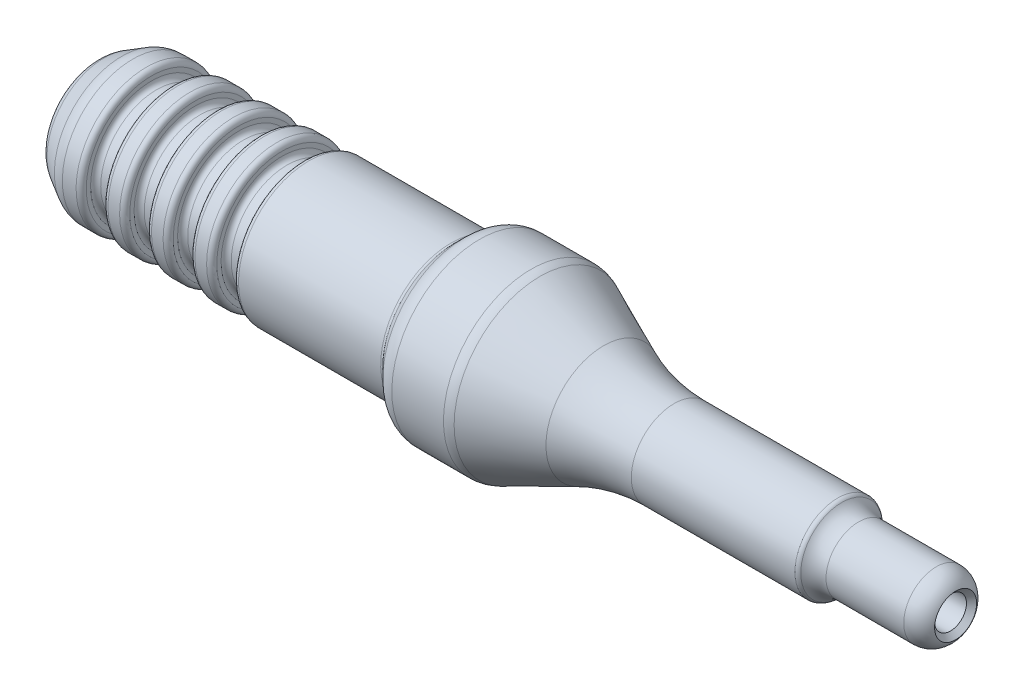
from build123d import *

# Parameters (mm, degrees)
SKETCH3_W     = 1.4999999999999991
SKETCH3_H     = 0.9999999999999996
SKETCH3_W_2   = 1.5
FILLET1_R     = 12
CHAMFER1_SIZE = 0.35
FILLET2_R     = 1.5
FILLET3_R     = 0.35
FILLET4_R     = 0.35


with BuildPart() as part:
    # Sketch1 → Revolve1 (revolve)
    with BuildSketch(Plane.XY):
        Polygon((0, 0), (0, 3.52), (2.2999999999999994, 4.847905619136144), (24.8, 4.847905619136144), (26, 6.047905619136149), (30.5, 6.047905619136149), (37.50000000000001, 2.9473941251088305), (51.50000000000001, 2.9473941251088296), (51.90264068586284, 2.249999999999999), (59.45264068586284, 2.2499999999999987), (59.452640685862846, 7e-17), align=None)
    revolve(axis=Axis((59.452640685862846, 7e-17, 0), (-1, 0, 0)))

    # Sketch2 → Cut-Revolve1 (revolve, cut)
    with BuildSketch(Plane.XY):
        Polygon((0, 2.25), (33.5, 2.25), (35.49185842870421, 1.0999999999999972), (59.45264068586284, 1.0999999999999972), (59.45264068586284, 0), (0, 0), align=None)
    revolve(axis=Axis((59.452640685862846, 7e-17, 0), (-1, 0, 0)), mode=Mode.SUBTRACT)

    # Sketch3 → Cut-Revolve2 (revolve, cut)
    with BuildSketch(Plane.XY):
        Polygon((4, 4.847905619136144), (5.5, 4.847905619136144), (5.5, 3.847905619136144), (4.000000000000001, 3.847905619136144), align=None)
        with Locations((7.75, 4.347905619136144)):
            Rectangle(SKETCH3_W, SKETCH3_H)
        Polygon((10, 4.847905619136144), (10.000000000000002, 3.847905619136144), (11.5, 3.847905619136144), (11.5, 4.847905619136144), align=None)
        with Locations((13.750000000000002, 4.347905619136144)):
            Rectangle(SKETCH3_W_2, SKETCH3_H)
    revolve(axis=Axis((59.452640685862846, 7e-17, 0), (-1, 0, 0)), mode=Mode.SUBTRACT)

    # Fillet1
    fillet1_edges = [part.edges().sort_by_distance(p)[0] for p in [
        (37.50000000000001, -2.9473941251088305, -3.6e-16),
    ]]
    fillet(fillet1_edges, radius=FILLET1_R)

    # Chamfer1
    chamfer1_edges = [part.edges().sort_by_distance(p)[0] for p in [
        (0, -2.25, -2.8e-16),
        (59.45264068586284, -1.0999999999999972, -1.3e-16),
    ]]
    chamfer(chamfer1_edges, length=CHAMFER1_SIZE)

    # Fillet2
    # the kernel refuses this fillet: 1.5 mm, written as the material it adds along each edge
    with BuildSketch(Plane(origin=(51.90264068586284, 6e-17, 0), x_dir=(0, 1, 0), z_dir=(0, 0, 1))) as fillet2_piece_1:
        with BuildLine():
            CenterArc((3.749999999999999, -0.864570350070089), FILLET2_R, 122.34869832224933, 57.651301677750666)
            Line((2.947394125108832, 0.40264068586282775), (2.9313420076110086, 0.4279849065814858))
            ThreePointArc((2.9313420076110086, 0.4279849065814858), (2.583697062554416, 0.22730110504495116), (2.2349999999999994, 0.02598076211353373))
            Line((2.2349999999999994, 0.02598076211353373), (2.2199999999999993, 0))
            Line((2.2199999999999993, 0), (2.2199999999999993, -0.864570350070089))
            Line((2.2199999999999993, -0.864570350070089), (2.249999999999999, -0.864570350070089))
        make_face()
    fillet2_piece_1_solid = revolve(axis=Axis((51.90264068586284, 6e-17, 0), (-1, 0, 0)), mode=Mode.PRIVATE)
    add([fillet2_piece_1_solid])
    # the kernel refuses this fillet: 1.5 mm, written as the material it takes off along each edge
    with BuildSketch(Plane(origin=(30.5, 4e-17, 0), x_dir=(0, 1, 0), z_dir=(0, 0, 1))) as fillet2_2_piece_1:
        with BuildLine():
            CenterArc((6.047905619136149 - FILLET2_R, FILLET2_R * 0.211553464978), FILLET2_R, 336.11, 23.88999999999998)
            Line((6.047905619136149, FILLET2_R * 0.211553464978), (6.047905619136149 + FILLET2_R * 0.02, FILLET2_R * 0.211553464978))
            Line((6.047905619136149 + FILLET2_R * 0.02, FILLET2_R * 0.211553464978), (6.047905619136149 + FILLET2_R * 0.02, -FILLET2_R * 0.00423106929956))
            Line((6.047905619136149 + FILLET2_R * 0.02, -FILLET2_R * 0.00423106929956), (6.047905619136149 - FILLET2_R * 0.0673888551076, -FILLET2_R * 0.201528188479))
            Line((6.047905619136149 - FILLET2_R * 0.0673888551076, -FILLET2_R * 0.201528188479), (6.047905619136149 - FILLET2_R * 0.0856753481447, -FILLET2_R * 0.193428548215))
        make_face()
    fillet2_2_piece_1_solid = revolve(axis=Axis((30.5, 4e-17, 0), (-1, 0, 0)), mode=Mode.PRIVATE)
    with BuildSketch(Plane(origin=(26, 3e-17, 0), x_dir=(0, 1, 0), z_dir=(0, 0, 1))) as fillet2_2_piece_2:
        with BuildLine():
            CenterArc((6.047905619136149 - FILLET2_R, -FILLET2_R * 0.414213562373), FILLET2_R, 0, 45.00000000000012)
            Line((6.047905619136149 - FILLET2_R * 0.292893218813, FILLET2_R * 0.292893218813), (6.047905619136149 - FILLET2_R * 0.27875108319, FILLET2_R * 0.307035354437))
            Line((6.047905619136149 - FILLET2_R * 0.27875108319, FILLET2_R * 0.307035354437), (6.047905619136149 + FILLET2_R * 0.02, FILLET2_R * 0.00828427124746))
            Line((6.047905619136149 + FILLET2_R * 0.02, FILLET2_R * 0.00828427124746), (6.047905619136149 + FILLET2_R * 0.02, -FILLET2_R * 0.414213562373))
            Line((6.047905619136149 + FILLET2_R * 0.02, -FILLET2_R * 0.414213562373), (6.047905619136149, -FILLET2_R * 0.414213562373))
        make_face()
    fillet2_2_piece_2_solid = revolve(axis=Axis((26, 3e-17, 0), (-1, 0, 0)), mode=Mode.PRIVATE)
    with BuildSketch(Plane(origin=(2.299999999999997, 0, 0), x_dir=(0, 1, 0), z_dir=(0, 0, 1))) as fillet2_2_piece_3:
        with BuildLine():
            CenterArc((4.847905619136144 - FILLET2_R, -FILLET2_R * 0.267949192431), FILLET2_R, 1.696e-14, 30.000000000000057)
            Line((4.847905619136144, -FILLET2_R * 0.267949192431), (4.847905619136144 + FILLET2_R * 0.02, -FILLET2_R * 0.267949192431))
            Line((4.847905619136144 + FILLET2_R * 0.02, -FILLET2_R * 0.267949192431), (4.847905619136144 + FILLET2_R * 0.02, FILLET2_R * 0.00535898384862))
            Line((4.847905619136144 + FILLET2_R * 0.02, FILLET2_R * 0.00535898384862), (4.847905619136144 - FILLET2_R * 0.11665408814, FILLET2_R * 0.242050807569))
            Line((4.847905619136144 - FILLET2_R * 0.11665408814, FILLET2_R * 0.242050807569), (4.847905619136144 - FILLET2_R * 0.133974596216, FILLET2_R * 0.232050807569))
        make_face()
    fillet2_2_piece_3_solid = revolve(axis=Axis((2.299999999999997, 0, 0), (-1, 0, 0)), mode=Mode.PRIVATE)
    with BuildSketch(Plane(origin=(0, 0, 0), x_dir=(0, 1, 0), z_dir=(0, 0, 1))) as fillet2_2_piece_4:
        with BuildLine():
            CenterArc((3.52 - FILLET2_R * 0.57735026919, -FILLET2_R), FILLET2_R, 30.0000000000001, 59.999999999999886)
            Line((3.52 + FILLET2_R * 0.288675134595, -FILLET2_R * 0.5), (3.52 + FILLET2_R * 0.305995642671, -FILLET2_R * 0.49))
            Line((3.52 + FILLET2_R * 0.305995642671, -FILLET2_R * 0.49), (3.52 + FILLET2_R * 0.0115470053838, FILLET2_R * 0.02))
            Line((3.52 + FILLET2_R * 0.0115470053838, FILLET2_R * 0.02), (3.52 - FILLET2_R * 0.57735026919, FILLET2_R * 0.02))
            Line((3.52 - FILLET2_R * 0.57735026919, FILLET2_R * 0.02), (3.52 - FILLET2_R * 0.57735026919, 0))
        make_face()
    fillet2_2_piece_4_solid = revolve(axis=Axis((0, 0, 0), (-1, 0, 0)), mode=Mode.PRIVATE)
    with BuildSketch(Plane(origin=(59.45264068586284, 7e-17, 0), x_dir=(0, 1, 0), z_dir=(0, 0, 1))) as fillet2_2_piece_5:
        with BuildLine():
            CenterArc((0.749999999999999, 1.3266499161421734), FILLET2_R, 297.81813928465357, 62.18186071534643)
            Line((2.249999999999999, 1.3266499161421734), (2.279999999999999, 1.3266499161421734))
            Line((2.279999999999999, 1.3266499161421734), (2.2799999999999985, 0))
            Line((2.2799999999999985, 0), (2.2499999999999987, -0.03000000000000114))
            ThreePointArc((2.2499999999999987, -0.03000000000000114), (1.8499999999999952, -0.03000000000000114), (1.4639999999999918, -0.02653299832283551))
            Line((1.4639999999999918, -0.02653299832283551), (1.449999999999992, 7.11e-15))
        make_face()
    fillet2_2_piece_5_solid = revolve(axis=Axis((59.45264068586284, 7e-17, 0), (-1, 0, 0)), mode=Mode.PRIVATE)
    add([fillet2_2_piece_1_solid, fillet2_2_piece_2_solid, fillet2_2_piece_3_solid, fillet2_2_piece_4_solid, fillet2_2_piece_5_solid], mode=Mode.SUBTRACT)

    # Fillet3
    fillet3_edges = [part.edges().sort_by_distance(p)[0] for p in [
        (4, -3.847905619136144, -4.7e-16),
        (5.5, -4.847905619136144, -5.9e-16),
        (4, -4.847905619136144, -5.9e-16),
        (7, -4.847905619136144, -5.9e-16),
        (8.5, -4.847905619136144, -5.9e-16),
        (8.5, -3.847905619136144, -4.7e-16),
        (7, -3.847905619136144, -4.7e-16),
        (10, -4.847905619136144, -5.9e-16),
        (11.5, -4.847905619136144, -5.9e-16),
        (11.5, -3.847905619136144, -4.7e-16),
        (10, -3.847905619136144, -4.7e-16),
        (13, -4.847905619136144, -5.9e-16),
        (14.5, -4.847905619136144, -5.9e-16),
        (14.5, -3.847905619136144, -4.7e-16),
        (13, -3.847905619136144, -4.7e-16),
    ]]
    fillet(fillet3_edges, radius=FILLET3_R)

    # Fillet4
    fillet4_edges = [part.edges().sort_by_distance(p)[0] for p in [
        (51.50000000000001, -2.9473941251088296, -3.6e-16),
        (24.799999999999997, -4.847905619136144, -5.9e-16),
    ]]
    fillet(fillet4_edges, radius=FILLET4_R)


solid = part.part
